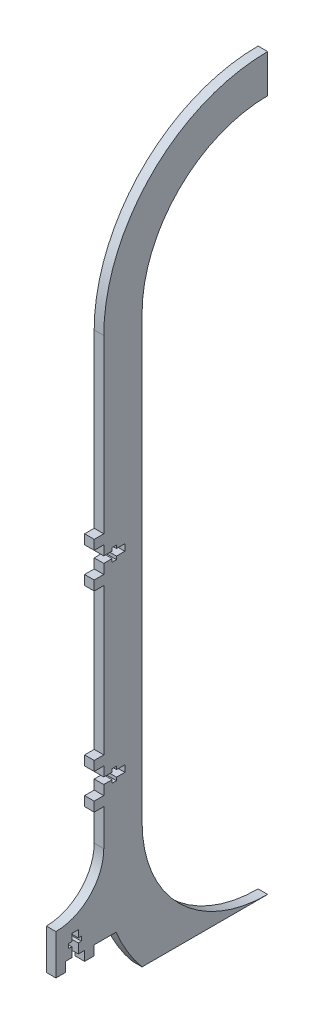
from build123d import *

# Parameters (mm, degrees)
BOSS_EXTRUDE2_DEPTH = 6.35


with BuildPart() as part:
    # Elevator Ball Support Rail → Boss-Extrude2 (new body)
    with BuildSketch(Plane(origin=(0, 0, 0), x_dir=(0, 0, -1), z_dir=(1, 0, 0))):
        with BuildLine():
            ThreePointArc((0, 146.05), (24.401519846, 204.960480154), (83.312, 229.362))
            Line((83.312, 229.362), (83.312, 254.762))
            ThreePointArc((83.312, 254.762), (6.441007604, 222.920992396), (-25.4, 146.05))
            Line((-25.4, 146.05), (-25.4, 32.131))
            Line((-25.4, 32.131), (-31.75, 32.131))
            Line((-31.75, 32.131), (-31.75, 25.781))
            Line((-31.75, 25.781), (-25.4, 25.781))
            Line((-25.4, 25.781), (-25.4, 19.431))
            Line((-25.4, 19.431), (-19.865000021, 19.431))
            Line((-19.865000021, 19.431), (-19.865000021, 21.471999982))
            Line((-19.865000021, 21.471999982), (-16.964999979, 21.471999982))
            Line((-16.964999979, 21.471999982), (-16.964999979, 19.431))
            Line((-16.964999979, 19.431), (-11.43, 19.431))
            Line((-11.43, 19.431), (-11.43, 15.113))
            Line((-11.43, 15.113), (-16.964999979, 15.113))
            Line((-16.964999979, 15.113), (-16.964999979, 13.072000018))
            Line((-16.964999979, 13.072000018), (-19.865000021, 13.072000018))
            Line((-19.865000021, 13.072000018), (-19.865000021, 15.113))
            Line((-19.865000021, 15.113), (-25.4, 15.113))
            Line((-25.4, 15.113), (-25.4, 8.763))
            Line((-25.4, 8.763), (-31.75, 8.763))
            Line((-31.75, 8.763), (-31.75, 2.413))
            Line((-31.75, 2.413), (-25.4, 2.413))
            Line((-25.4, 2.413), (-25.4, -94.869))
            Line((-25.4, -94.869), (-31.75, -94.869))
            Line((-31.75, -94.869), (-31.75, -101.219))
            Line((-31.75, -101.219), (-25.4, -101.219))
            Line((-25.4, -101.219), (-25.4, -107.569))
            Line((-25.4, -107.569), (-19.865000021, -107.569))
            Line((-19.865000021, -107.569), (-19.865000021, -105.528000018))
            Line((-19.865000021, -105.528000018), (-16.964999979, -105.528000018))
            Line((-16.964999979, -105.528000018), (-16.964999979, -107.569))
            Line((-16.964999979, -107.569), (-11.43, -107.569))
            Line((-11.43, -107.569), (-11.43, -111.887))
            Line((-11.43, -111.887), (-16.964999979, -111.887))
            Line((-16.964999979, -111.887), (-16.964999979, -113.927999982))
            Line((-16.964999979, -113.927999982), (-19.865000021, -113.927999982))
            Line((-19.865000021, -113.927999982), (-19.865000021, -111.887))
            Line((-19.865000021, -111.887), (-25.4, -111.887))
            Line((-25.4, -111.887), (-25.4, -118.237))
            Line((-25.4, -118.237), (-31.75, -118.237))
            Line((-31.75, -118.237), (-31.75, -124.587))
            Line((-31.75, -124.587), (-25.4, -124.587))
            Line((-25.4, -124.587), (-25.4, -142.367))
            Line((-25.4, -142.367), (-25.4, -148.717))
            ThreePointArc((-25.4, -148.717), (-34.699359697, -171.167640303), (-57.15, -180.467))
            Line((-57.15, -180.467), (-57.15, -207.137))
            Line((-57.15, -207.137), (-50.8, -207.137))
            Line((-50.8, -207.137), (-50.8, -200.787))
            Line((-50.8, -200.787), (-46.609, -200.787))
            Line((-46.609, -200.787), (-46.609, -194.437))
            Line((-46.609, -194.437), (-48.649999982, -194.437))
            Line((-48.649999982, -194.437), (-48.649999982, -191.536999958))
            Line((-48.649999982, -191.536999958), (-46.609, -191.536999958))
            Line((-46.609, -191.536999958), (-46.609, -186.817))
            Line((-46.609, -186.817), (-42.291, -186.817))
            Line((-42.291, -186.817), (-42.291, -191.536999958))
            Line((-42.291, -191.536999958), (-40.250000018, -191.536999958))
            Line((-40.250000018, -191.536999958), (-40.250000018, -194.437))
            Line((-40.250000018, -194.437), (-42.291, -194.437))
            Line((-42.291, -194.437), (-42.291, -200.787))
            Line((-42.291, -200.787), (-38.1, -200.787))
            Line((-38.1, -200.787), (-38.1, -207.137))
            Line((-38.1, -207.137), (-31.75, -207.137))
            Line((-31.75, -207.137), (-31.75, -200.787))
            Line((-31.75, -200.787), (-17.26447012, -200.787))
            ThreePointArc((-17.26447012, -200.787), (-9.735702911, -215.741194234), (0, -229.362))
            Line((0, -229.362), (83.312, -229.362))
            ThreePointArc((83.312, -229.362), (24.401519846, -204.960480154), (0, -146.05))
            Line((0, -146.05), (0, 146.05))
        make_face()
    extrude(amount=BOSS_EXTRUDE2_DEPTH)


solid = part.part
